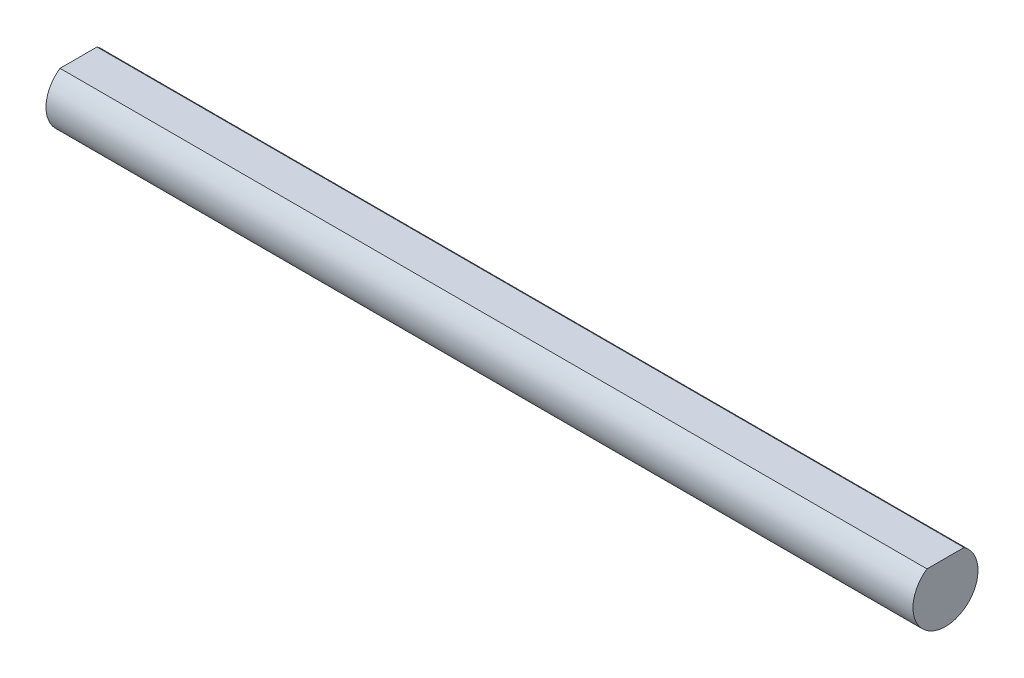
from build123d import *

# Parameters (mm, degrees)
BOSS_EXTRUDE1_DEPTH = 25


with BuildPart() as part:
    # Sketch1 → Boss-Extrude1 (new, symmetric)
    with BuildSketch(Plane(origin=(0, 0, 0), x_dir=(0, 0, -1), z_dir=(1, 0, 0))):
        with BuildLine():
            Line((1.066657148, 1.542033569), (-1.066657148, 1.542033569))
            ThreePointArc((-1.066657148, 1.542033569), (0, -1.875), (1.066657148, 1.542033569))
        make_face()
    extrude(amount=BOSS_EXTRUDE1_DEPTH, both=True)


solid = part.part
